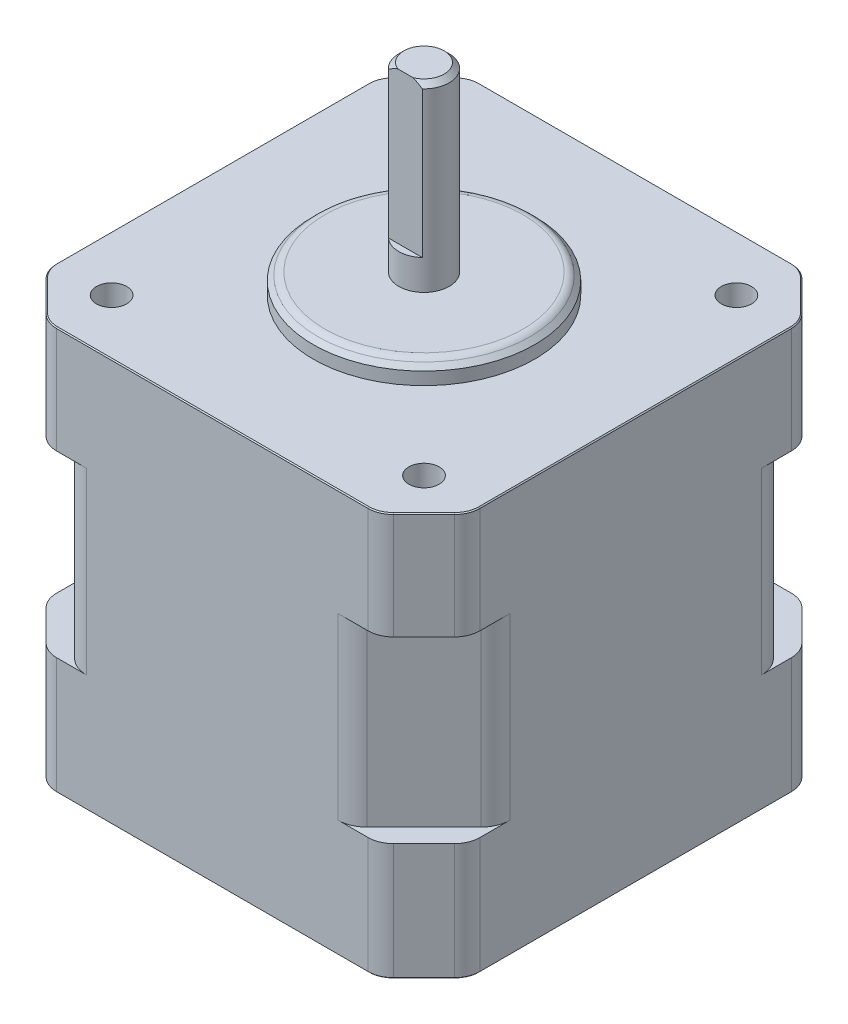
from build123d import *

# Parameters (mm, degrees)
BOSS_EXTRUDE1_DEPTH          = 40
CUT_EXTRUDE1_DEPTH           = 0.7
CUT_EXTRUDE2_DEPTH           = 0.7
CUT_EXTRUDE3_DEPTH           = 0.7
CUT_EXTRUDE4_DEPTH           = 0.7
CUT_EXTRUDE5_DEPTH           = 0.7
CUT_EXTRUDE6_DEPTH           = 0.7
CUT_EXTRUDE7_DEPTH           = 0.7
CUT_EXTRUDE8_DEPTH           = 0.7
CUT_EXTRUDE9_DEPTH           = 0.7
CUT_EXTRUDE10_DEPTH          = 0.7
CUT_EXTRUDE11_DEPTH          = 0.7
CUT_EXTRUDE12_DEPTH          = 0.7
CUT_THICKEN1_START           = 11.62
CUT_THICKEN1_DEPTH           = 17.76
CUT_THICKEN2_START           = 11.62
CUT_THICKEN2_DEPTH           = 17.76
CUT_THICKEN3_START           = 11.62
CUT_THICKEN3_DEPTH           = 17.76
CUT_THICKEN4_START           = 11.62
CUT_THICKEN4_DEPTH           = 17.76
SKETCH16_R                   = 11
BOSS_EXTRUDE2_DEPTH          = 1.75
SKETCH17_R                   = 11
BOSS_EXTRUDE3_DEPTH          = 0.75
BOSS_EXTRUDE3_TAPER          = 45
SKETCH18_R                   = 2.5
BOSS_EXTRUDE4_DEPTH          = 18
CUT_EXTRUDE13_START          = -15
CUT_EXTRUDE13_DEPTH          = 15
F_3_0_3_DIAMETER_HOLE1_D     = 3
F_3_0_3_DIAMETER_HOLE1_DEPTH = 7
FILLET1_R                    = 2.5
CHAMFER1_SIZE                = 0.5
CHAMFER2_SIZE                = 0.1
FILLET2_R                    = 1
FILLET3_R                    = 2.873613331


# Read off the part's stored shape, not the designer's step: Cut-Thicken1, Cut-Thicken2, Cut-Thicken3, Cut-Thicken4
with BuildPart() as part:
    # Sketch1 → Boss-Extrude1 (new body)
    with BuildSketch(Plane.XZ):
        Polygon((-16.5, 21), (-21, 16.5), (-21, -16.5), (-16.5, -21), (16.5, -21), (21, -16.5), (21, 16.5), (16.5, 21), align=None)
    extrude(amount=-BOSS_EXTRUDE1_DEPTH)

    # Sketch2 → Cut-Extrude1 (cut)
    with BuildSketch(Plane.XY.offset(15.85)):
        Polygon((13.55, 1.25), (13.55, 0), (17.45, 0), (17.45, 1.25), (16.95, 2), (14.05, 2), align=None)
    extrude(amount=-CUT_EXTRUDE1_DEPTH, mode=Mode.SUBTRACT)

    # Sketch3 → Cut-Extrude2 (cut)
    with BuildSketch(Plane(origin=(0, 0, -15.85), x_dir=(-1, 0, 0), z_dir=(0, 0, -1))):
        Polygon((-17.45, 1.25), (-17.45, 0), (-13.55, 0), (-13.55, 1.25), (-14.05, 2), (-16.95, 2), align=None)
    extrude(amount=-CUT_EXTRUDE2_DEPTH, mode=Mode.SUBTRACT)

    # Sketch4 → Cut-Extrude3 (cut)
    with BuildSketch(Plane(origin=(0, 0, -15.85), x_dir=(-1, 0, 0), z_dir=(0, 0, -1))):
        Polygon((13.55, 1.25), (13.55, 0), (17.45, 0), (17.45, 1.25), (16.95, 2), (14.05, 2), align=None)
    extrude(amount=-CUT_EXTRUDE3_DEPTH, mode=Mode.SUBTRACT)

    # Sketch5 → Cut-Extrude4 (cut)
    with BuildSketch(Plane.XY.offset(15.85)):
        Polygon((-17.45, 1.25), (-17.45, 0), (-13.55, 0), (-13.55, 1.25), (-14.05, 2), (-16.95, 2), align=None)
    extrude(amount=-CUT_EXTRUDE4_DEPTH, mode=Mode.SUBTRACT)

    # Sketch6 → Cut-Extrude5 (cut)
    with BuildSketch(Plane(origin=(-15.85, 0, 0), x_dir=(0, -1, 0), z_dir=(-1, 0, 0))):
        Polygon((-2, 16.95), (-2, 15.85), (0, 15.85), (0, 17.45), (-1.25, 17.45), align=None)
    extrude(amount=-CUT_EXTRUDE5_DEPTH, mode=Mode.SUBTRACT)

    # Sketch7 → Cut-Extrude6 (cut)
    with BuildSketch(Plane(origin=(15.15, 0, 0), x_dir=(0, -1, 0), z_dir=(-1, 0, 0))):
        Polygon((-2, 16.95), (-2, 15.85), (0, 15.85), (0, 17.45), (-1.25, 17.45), align=None)
    extrude(amount=-CUT_EXTRUDE6_DEPTH, mode=Mode.SUBTRACT)

    # Sketch8 → Cut-Extrude7 (cut)
    with BuildSketch(Plane(origin=(15.15, 0, 0), x_dir=(0, -1, 0), z_dir=(-1, 0, 0))):
        Polygon((-1.25, 13.55), (0, 13.55), (0, 15.15), (-2, 15.15), (-2, 14.05), align=None)
    extrude(amount=-CUT_EXTRUDE7_DEPTH, mode=Mode.SUBTRACT)

    # Sketch9 → Cut-Extrude8 (cut)
    with BuildSketch(Plane(origin=(15.85, 0, 0), x_dir=(0, 0, -1), z_dir=(1, 0, 0))):
        Polygon((16.95, 2), (15.85, 2), (15.85, 0), (17.45, 0), (17.45, 1.25), align=None)
    extrude(amount=-CUT_EXTRUDE8_DEPTH, mode=Mode.SUBTRACT)

    # Sketch10 → Cut-Extrude9 (cut)
    with BuildSketch(Plane(origin=(15.85, 0, 0), x_dir=(0, 0, -1), z_dir=(1, 0, 0))):
        Polygon((13.55, 1.25), (13.55, 0), (15.15, 0), (15.15, 2), (14.05, 2), align=None)
    extrude(amount=-CUT_EXTRUDE9_DEPTH, mode=Mode.SUBTRACT)

    # Sketch11 → Cut-Extrude10 (cut)
    with BuildSketch(Plane(origin=(-15.15, 0, 0), x_dir=(0, 0, -1), z_dir=(1, 0, 0))):
        Polygon((16.95, 2), (15.85, 2), (15.85, 0), (17.45, 0), (17.45, 1.25), align=None)
    extrude(amount=-CUT_EXTRUDE10_DEPTH, mode=Mode.SUBTRACT)

    # Sketch12 → Cut-Extrude11 (cut)
    with BuildSketch(Plane(origin=(-15.15, 0, 0), x_dir=(0, 0, -1), z_dir=(1, 0, 0))):
        Polygon((13.55, 1.25), (13.55, 0), (15.15, 0), (15.15, 2), (14.05, 2), align=None)
    extrude(amount=-CUT_EXTRUDE11_DEPTH, mode=Mode.SUBTRACT)

    # Sketch13 → Cut-Extrude12 (cut)
    with BuildSketch(Plane(origin=(-15.15, 0, 0), x_dir=(0, 0, -1), z_dir=(1, 0, 0))):
        Polygon((-14.05, 2), (-15.15, 2), (-15.15, 0), (-13.55, 0), (-13.55, 1.25), align=None)
    extrude(amount=-CUT_EXTRUDE12_DEPTH, mode=Mode.SUBTRACT)

    # Cut-Thicken1 outline → Cut-Thicken1 (cut)
    with BuildSketch(Plane(origin=(0, 0, 0), x_dir=(1, 0, 0), z_dir=(0, 1, 0)).offset(CUT_THICKEN1_START)):
        Polygon((13.671572875, 21), (21, 13.671572875), (21, 16.5), (16.5, 21), align=None)
    extrude(amount=CUT_THICKEN1_DEPTH, mode=Mode.SUBTRACT)

    # Cut-Thicken2 outline → Cut-Thicken2 (cut)
    with BuildSketch(Plane(origin=(0, 0, 0), x_dir=(1, 0, 0), z_dir=(0, 1, 0)).offset(CUT_THICKEN2_START)):
        Polygon((21, -13.671572875), (13.671572875, -21), (16.5, -21), (21, -16.5), align=None)
    extrude(amount=CUT_THICKEN2_DEPTH, mode=Mode.SUBTRACT)

    # Cut-Thicken3 outline → Cut-Thicken3 (cut)
    with BuildSketch(Plane(origin=(0, 0, 0), x_dir=(1, 0, 0), z_dir=(0, 1, 0)).offset(CUT_THICKEN3_START)):
        Polygon((-16.5, -21), (-13.671572875, -21), (-21, -13.671572875), (-21, -16.5), align=None)
    extrude(amount=CUT_THICKEN3_DEPTH, mode=Mode.SUBTRACT)

    # Cut-Thicken4 outline → Cut-Thicken4 (cut)
    with BuildSketch(Plane(origin=(0, 0, 0), x_dir=(1, 0, 0), z_dir=(0, 1, 0)).offset(CUT_THICKEN4_START)):
        Polygon((-21, 16.5), (-21, 13.671572875), (-13.671572875, 21), (-16.5, 21), align=None)
    extrude(amount=CUT_THICKEN4_DEPTH, mode=Mode.SUBTRACT)

    # Sketch16 → Boss-Extrude2 (add)
    with BuildSketch(Plane.XZ.offset(-39.5)):
        with Locations(Location((0, 0, 0), (0, 0, 270))):
            Circle(SKETCH16_R)
    extrude(amount=-BOSS_EXTRUDE2_DEPTH)

    # Sketch17 → Boss-Extrude3 (add)
    with BuildSketch(Plane(origin=(0, 41.25, 0), x_dir=(-1, 0, 0), z_dir=(0, 1, 0))):
        with Locations(Location((0, 0, 0), (0, 0, 270))):
            Circle(SKETCH17_R)
    extrude(amount=BOSS_EXTRUDE3_DEPTH, taper=BOSS_EXTRUDE3_TAPER)

    # Sketch18 → Boss-Extrude4 (add)
    with BuildSketch(Plane(origin=(0, 42, 0), x_dir=(-1, 0, 0), z_dir=(0, 1, 0))):
        with Locations(Location((0, 0, 0), (0, 0, 90))):
            Circle(SKETCH18_R)
    extrude(amount=BOSS_EXTRUDE4_DEPTH)

    # Sketch19 → Cut-Extrude13 (cut)
    with BuildSketch(Plane(origin=(0, 60, 0), x_dir=(-1, 0, 0), z_dir=(0, 1, 0)).offset(CUT_EXTRUDE13_START)):
        with BuildLine():
            Line((-1.681517172, 1.85), (1.681517172, 1.85))
            ThreePointArc((1.681517172, 1.85), (0, 2.5), (-1.681517172, 1.85))
        make_face()
    extrude(amount=CUT_EXTRUDE13_DEPTH, mode=Mode.SUBTRACT)

    # Sketch20 → Cut-Revolve1 (revolve, cut)
    with BuildSketch(Plane(origin=(-15.5, 0, 0), x_dir=(0, 0, -1), z_dir=(1, 0, 0))):
        Polygon((-18.875, 0), (-15.5, 0), (-15.5, 0.75), (-18.125, 0.75), align=None)
    revolve(axis=Axis((-15.5, 0, 15.5), (0, 1, 0)), mode=Mode.SUBTRACT)

    # Sketch21 → Cut-Revolve2 (revolve, cut)
    with BuildSketch(Plane(origin=(15.5, 0, 0), x_dir=(0, 0, -1), z_dir=(1, 0, 0))):
        Polygon((-15.5, 0), (-12.125, 0), (-12.875, 0.75), (-15.5, 0.75), align=None)
    revolve(axis=Axis((15.5, 0.75, 15.5), (0, -1, 0)), mode=Mode.SUBTRACT)

    # Sketch22 → Cut-Revolve3 (revolve, cut)
    with BuildSketch(Plane(origin=(15.5, 0, 0), x_dir=(0, 0, -1), z_dir=(1, 0, 0))):
        Polygon((15.5, 0), (18.875, 0), (18.125, 0.75), (15.5, 0.75), align=None)
    revolve(axis=Axis((15.5, 0.75, -15.5), (0, -1, 0)), mode=Mode.SUBTRACT)

    # Sketch23 → Cut-Revolve4 (revolve, cut)
    with BuildSketch(Plane(origin=(-15.5, 0, 0), x_dir=(0, 0, -1), z_dir=(1, 0, 0))):
        Polygon((12.125, 0), (15.5, 0), (15.5, 0.75), (12.875, 0.75), align=None)
    revolve(axis=Axis((-15.5, 0, -15.5), (0, 1, 0)), mode=Mode.SUBTRACT)

    # Sketch24 → Cut-Revolve5 (revolve, cut)
    with BuildSketch(Plane(origin=(0, 0, 0), x_dir=(-1, 0, 0), z_dir=(0, 0, -1)), mode=Mode.PRIVATE) as cut_revolve5_sk:
        Polygon((-4.5, 0), (0, 0), (0, 3), (-2.5, 3), (-2.5, 3.5), (-3, 4), (-3, 5), (-4, 5), (-4, 4.5), (-4.5, 4), (-10, 4), (-10, 3), (-4.5, 3), align=None)
    revolve(cut_revolve5_sk.sketch.rotate(Axis((0, 0, 0), (0, 1, 0)), 270), axis=Axis((0, 0, 0), (0, 1, 0)), mode=Mode.SUBTRACT)

    # Ø3.0 (3) Diameter Hole1
    with Locations(Plane(origin=(0, 40, 0), x_dir=(1, 0, 0), z_dir=(0, 1, 0))):
        with Locations((-15.5, -15.5), (15.5, -15.5), (15.5, 15.5), (-15.5, 15.5)):
            Hole(F_3_0_3_DIAMETER_HOLE1_D / 2, depth=F_3_0_3_DIAMETER_HOLE1_DEPTH)

    # Fillet1
    fillet1_edges = [part.edges().sort_by_distance(p)[0] for p in [
        (-16.5, 5.81, 21),
        (21, 5.81, 16.5),
        (21, 34.69, -16.5),
        (-21, 5.81, -16.5),
        (16.5, 34.69, 21),
        (16.5, 34.69, -21),
        (21, 5.81, -16.5),
        (-21, 34.69, 16.5),
        (-16.5, 34.69, 21),
        (-16.5, 5.81, -21),
        (16.5, 5.81, 21),
        (-16.5, 34.69, -21),
        (-21, 34.69, -16.5),
        (21, 34.69, 16.5),
        (-21, 5.81, 16.5),
        (16.5, 5.81, -21),
    ]]
    fillet(fillet1_edges, radius=FILLET1_R)

    # Chamfer1
    chamfer1_edges = [part.edges().sort_by_distance(p)[0] for p in [
        (0, 60, -2.5),
    ]]
    chamfer(chamfer1_edges, length=CHAMFER1_SIZE)

    # Chamfer2
    chamfer2_edges = [part.edges().sort_by_distance(p)[0] for p in [
        (0, 0, 21),
        (0, 40, 21),
        (-18.75, 0, 18.75),
        (-21, 0, 0),
        (-18.75, 0, -18.75),
        (0, 0, -21),
        (18.75, 0, -18.75),
        (21, 0, 0),
        (18.75, 0, 18.75),
        (16.421174675, 0, -20.809698831),
        (-20.809698831, 0, 16.421174675),
        (16.421174675, 0, 20.809698831),
        (-16.421174675, 0, -20.809698831),
        (20.809698831, 0, -16.421174675),
        (-20.809698831, 0, -16.421174675),
        (20.809698831, 0, 16.421174675),
        (-16.421174675, 0, 20.809698831),
        (21, 40, 0),
        (18.75, 40, -18.75),
        (18.75, 40, 18.75),
        (0, 40, -21),
        (-18.75, 40, -18.75),
        (-21, 40, 0),
        (-18.75, 40, 18.75),
        (20.809698831, 40, 16.421174675),
        (-20.809698831, 40, -16.421174675),
        (-16.421174675, 40, -20.809698831),
        (-16.421174675, 40, 20.809698831),
        (-20.809698831, 40, 16.421174675),
        (16.421174675, 40, -20.809698831),
        (16.421174675, 40, 20.809698831),
        (20.809698831, 40, -16.421174675),
    ]]
    chamfer(chamfer2_edges, length=CHAMFER2_SIZE)

    # Fillet2
    fillet2_edges = [part.edges().sort_by_distance(p)[0] for p in [
        (0, 42, 10.25),
    ]]
    fillet(fillet2_edges, radius=FILLET2_R)

    # Fillet3
    fillet3_edges = [part.edges().sort_by_distance(p)[0] for p in [
        (-21, 20.5, -13.671572875),
        (-13.671572875, 20.5, 21),
        (21, 20.5, -13.671572875),
        (-21, 20.5, 13.671572875),
        (13.671572875, 20.5, 21),
        (-13.671572875, 20.5, -21),
        (21, 20.5, 13.671572875),
        (13.671572875, 20.5, -21),
    ]]
    fillet(fillet3_edges, radius=FILLET3_R)


solid = part.part
